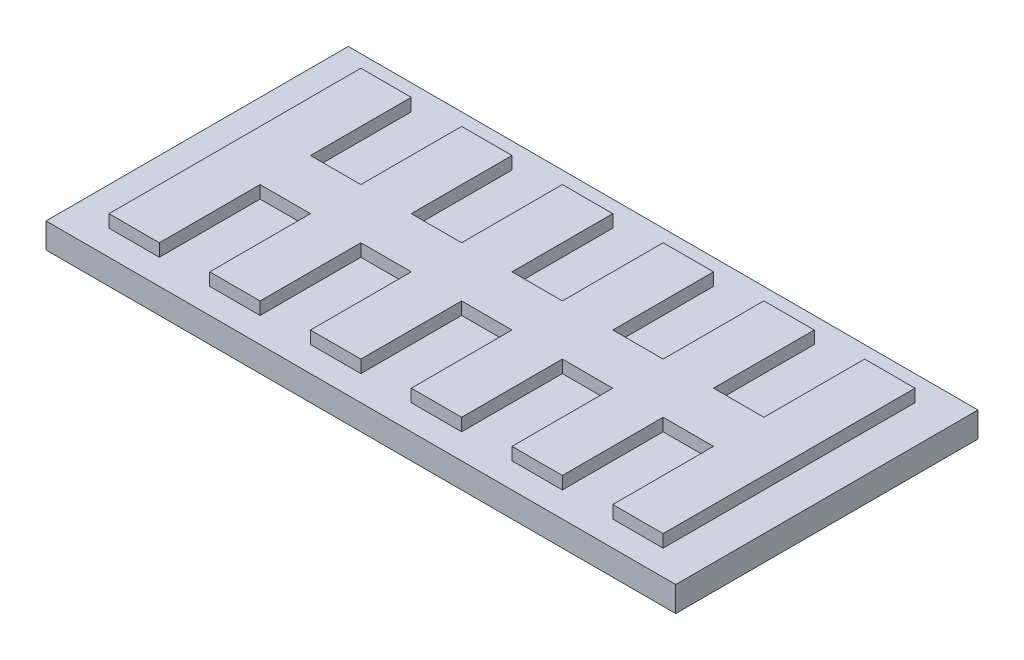
from build123d import *

# Parameters (mm, degrees)
SKETCH1_W           = 25
SKETCH1_H           = 12
BOSS_EXTRUDE1_DEPTH = 1
WRAP1_DEPTH         = 0.5


# Read off the part's stored shape, not the designer's step: Wrap1
with BuildPart() as part:
    # Sketch1 → Boss-Extrude1 (new body)
    with BuildSketch(Plane(origin=(0, 0, 0), x_dir=(1, 0, 0), z_dir=(0, 1, 0))):
        Rectangle(SKETCH1_W, SKETCH1_H)
    extrude(amount=BOSS_EXTRUDE1_DEPTH)

    # Wrap1 outline → Wrap1 (add)
    with BuildSketch(Plane(origin=(0, 1, 0), x_dir=(1, 0, 0), z_dir=(0, 1, 0))):
        Polygon((-11, -5), (-9, -5), (-9, -1), (-7, -1), (-7, -5), (-5, -5), (-5, -1), (-3, -1), (-3, -5), (-1, -5), (-1, -1), (1, -1), (1, -5), (3, -5), (3, -1), (5, -1), (5, -5), (7, -5), (7, -1), (9, -1), (9, -5), (11, -5), (11, 5), (9, 5), (9, 1), (7, 1), (7, 5), (5, 5), (5, 1), (3, 1), (3, 5), (1, 5), (1, 1), (-1, 1), (-1, 5), (-3, 5), (-3, 1), (-5, 1), (-5, 5), (-7, 5), (-7, 1), (-9, 1), (-9, 5), (-11, 5), align=None)
    extrude(amount=WRAP1_DEPTH)


solid = part.part
